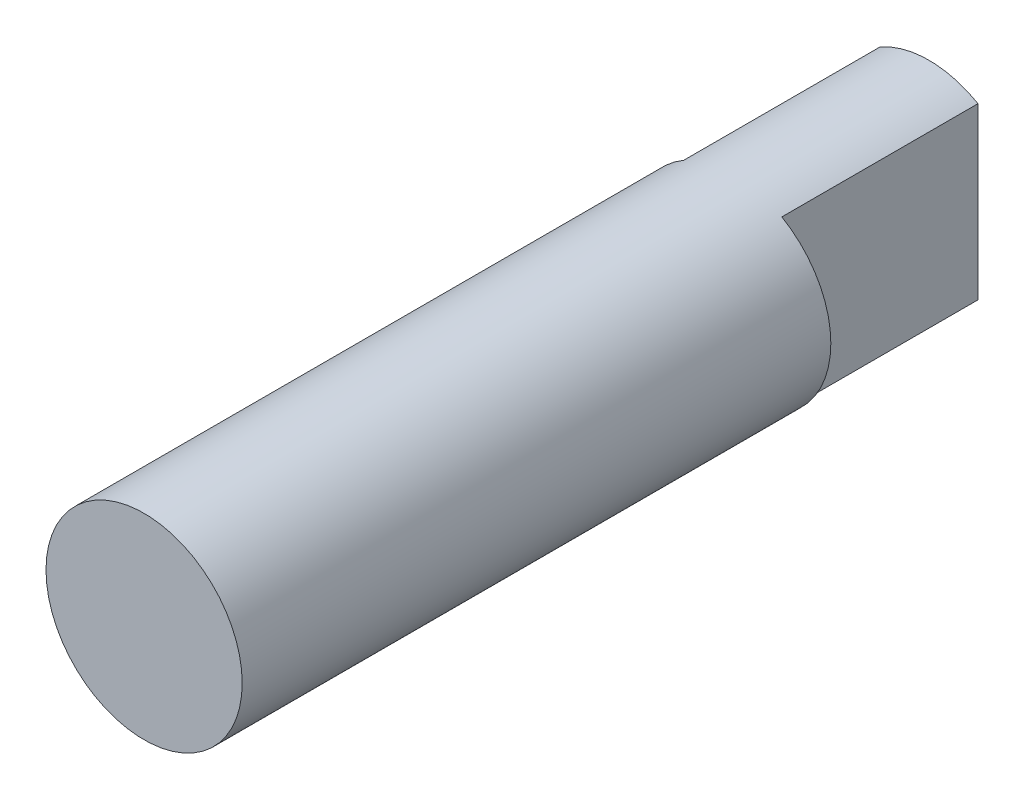
from build123d import *

# Parameters (mm, degrees)
BOSS_EXTRUDE1_DEPTH      = 88.9
BOSS_EXTRUDE1_DEPTH_BACK = 12.7
SKETCH1_R                = 12.7
CUT_EXTRUDE1_DEPTH       = 91.696141042
CUT_EXTRUDE1_DEPTH_BACK  = 91.696141042
SKETCH2_W                = 6.35
SKETCH2_H                = 25.4


with BuildPart() as part:
    # Sketch1 → Boss-Extrude1 (new, two sides: drawn at the far end of the back side and taken through both)
    with BuildSketch(Plane.XY.offset(-BOSS_EXTRUDE1_DEPTH_BACK)):
        Circle(SKETCH1_R)
    extrude(amount=BOSS_EXTRUDE1_DEPTH + BOSS_EXTRUDE1_DEPTH_BACK)

    # Sketch2 → Cut-Extrude1 (cut, two sides: drawn at the far end of the back side and taken through both)
    with BuildSketch(Plane(origin=(0, 0, 0), x_dir=(1, 0, 0), z_dir=(0, 1, 0)).offset(-CUT_EXTRUDE1_DEPTH_BACK)):
        with Locations((9.525, 0)):
            Rectangle(SKETCH2_W, SKETCH2_H)
        with Locations((-9.525, 0)):
            Rectangle(SKETCH2_W, SKETCH2_H)
    extrude(amount=CUT_EXTRUDE1_DEPTH + CUT_EXTRUDE1_DEPTH_BACK, mode=Mode.SUBTRACT)


solid = part.part
